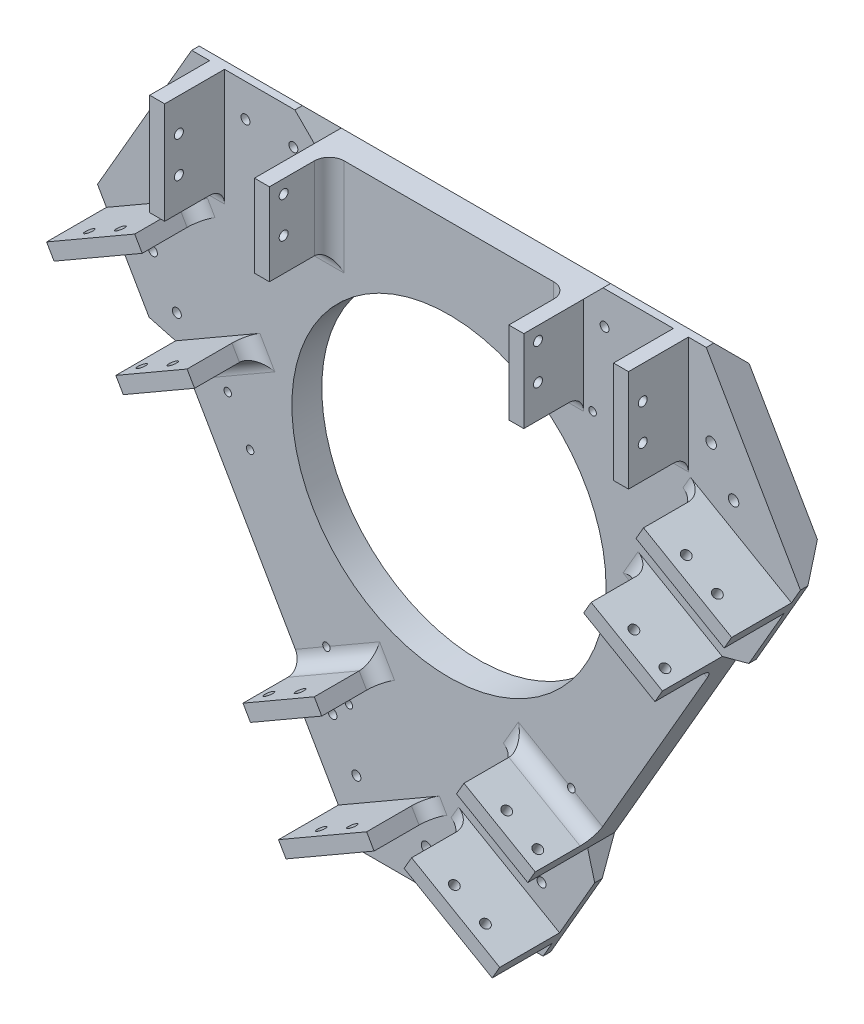
from build123d import *

# Parameters (mm, degrees)
ESQUISSE1_R                  = 52.5
BOSS_EXTRU_1_DEPTH           = 10
ESQUISSE2_W                  = 5
ESQUISSE2_H                  = 34
BOSS_EXTRU_2_DEPTH           = 20
CONG_1_R                     = 5
ESQUISSE3_R                  = 1.5
ENL_V_MAT_EXTRU_1_DEPTH      = 232.694205151
ENL_V_MAT_EXTRU_2_REACH      = 170.79
ESQUISSE4_R                  = 1.5
ESQUISSE5_R                  = 3
ENL_V_MAT_EXTRU_3_DEPTH      = 4.25
ENL_V_MAT_EXTRU_4_REACH      = 170.79
ESQUISSE6_W                  = 90
ESQUISSE6_H                  = 6.5
R_P_TITION_CIRCULAIRE3_COUNT = 3
CHANFREIN1_SIZE              = 6.5
CHANFREIN2_SIZE              = 7.5
ENL_V_MAT_EXTRU_5_REACH      = 170.79
ESQUISSE7_R                  = 1.75
ESQUISSE8_R                  = 3.5
ENL_V_MAT_EXTRU_6_DEPTH      = 4
R_P_TITION_CIRCULAIRE4_COUNT = 3
ENL_V_MAT_EXTRU_7_REACH      = 170.79
ESQUISSE9_R                  = 1.25


with BuildPart() as part:
    # Esquisse1 → Boss.-Extru.1 (new body)
    with BuildSketch(Plane.XY):
        Polygon((-85.980761818, 85.980761818), (85.980761818, 85.980761818), (117.45190488, 31.471143062), (31.471143062, -117.45190488), (-31.471143062, -117.45190488), (-117.45190488, 31.471143062), align=None)
        Circle(ESQUISSE1_R, mode=Mode.SUBTRACT)
    extrude(amount=BOSS_EXTRU_1_DEPTH)

    # Esquisse2 → Boss.-Extru.2 (add)
    with BuildSketch(Plane.XY.offset(10)):
        with Locations((77.5, 68.980761818)):
            Rectangle(ESQUISSE2_W, ESQUISSE2_H)
        with Locations((42.5, 68.980761818)):
            Rectangle(ESQUISSE2_W, ESQUISSE2_H)
        with Locations((-42.5, 68.980761818)):
            Rectangle(ESQUISSE2_W, ESQUISSE2_H)
        with Locations((-77.5, 68.980761818)):
            Rectangle(ESQUISSE2_W, ESQUISSE2_H)
        Polygon((34.461523971, -112.272413212), (5.016660242, -95.272413212), (7.516660242, -90.942286193), (36.961523971, -107.942286193), align=None)
        Polygon((51.961523971, -81.961524079), (22.516660242, -64.961524079), (25.016660242, -60.63139706), (54.461523971, -77.63139706), align=None)
        Polygon((94.461523971, -8.349364758), (65.016660242, 8.650635242), (67.516660242, 12.980762261), (96.961523971, -4.019237739), align=None)
        Polygon((111.961523971, 21.961524375), (82.516660242, 38.961524375), (85.016660242, 43.291651394), (114.461523971, 26.291651394), align=None)
        Polygon((-114.461523971, 26.291651394), (-85.016660242, 43.291651394), (-82.516660242, 38.961524375), (-111.961523971, 21.961524375), align=None)
        Polygon((-96.961523971, -4.019237739), (-67.516660242, 12.980762261), (-65.016660242, 8.650635242), (-94.461523971, -8.349364758), align=None)
        Polygon((-54.461523971, -77.63139706), (-25.016660242, -60.63139706), (-22.516660242, -64.961524079), (-51.961523971, -81.961524079), align=None)
        Polygon((-36.961523971, -107.942286193), (-7.516660242, -90.942286193), (-5.016660242, -95.272413212), (-34.461523971, -112.272413212), align=None)
    extrude(amount=BOSS_EXTRU_2_DEPTH)

    # Congé1
    cong_1_edges = [part.edges().sort_by_distance(p)[0] for p in [
        (83.766660242, 41.126587884, 10),
        (-83.766660242, 41.126587884, 10),
        (-79.739092107, 0.150635242, 10),
        (-66.266660242, 10.815698752, 10),
        (-23.766660242, -62.79646057, 10),
        (-39.739092107, -69.13139706, 10),
        (-6.266660242, -93.107349702, 10),
        (77.5, 51.980761818, 10),
        (40, 68.980761818, 10),
        (42.5, 51.980761818, 10),
        (-40, 68.980761818, 10),
        (-42.5, 51.980761818, 10),
        (-77.5, 51.980761818, 10),
        (6.266660242, -93.107349702, 10),
        (39.739092107, -69.13139706, 10),
        (23.766660242, -62.79646057, 10),
        (66.266660242, 10.815698752, 10),
        (79.739092107, 0.150635242, 10),
    ]]
    fillet(cong_1_edges, radius=CONG_1_R)

    # Esquisse3 → Enlèv. mat.-Extru.1 (cut, through all)
    with BuildSketch(Plane.ZY.offset(80)):
        with Locations((25.25, 74.980761818)):
            Circle(ESQUISSE3_R)
        with Locations((25.25, 62.980761818)):
            Circle(ESQUISSE3_R)
    enl_v_mat_extru_1 = extrude(amount=-ENL_V_MAT_EXTRU_1_DEPTH, mode=Mode.SUBTRACT)

    # Esquisse4 → Enlèv. mat.-Extru.2 (cut, up to next)
    with BuildSketch(Plane(origin=(0, 0, 0), x_dir=(-1, 0, 0), z_dir=(0, 0, -1)), mode=Mode.PRIVATE) as enl_v_mat_extru_2_sk1:
        with Locations((68, 74.980761818)):
            Circle(ESQUISSE4_R)
    enl_v_mat_extru_2_tool1 = extrude(enl_v_mat_extru_2_sk1.sketch, amount=-ENL_V_MAT_EXTRU_2_REACH, mode=Mode.PRIVATE) & part.part
    # Esquisse4 → Enlèv. mat.-Extru.2 (cut, up to next)
    with BuildSketch(Plane(origin=(0, 0, 0), x_dir=(-1, 0, 0), z_dir=(0, 0, -1)), mode=Mode.PRIVATE) as enl_v_mat_extru_2_sk2:
        with Locations((52, 74.980761818)):
            Circle(ESQUISSE4_R)
    enl_v_mat_extru_2_tool2 = extrude(enl_v_mat_extru_2_sk2.sketch, amount=-ENL_V_MAT_EXTRU_2_REACH, mode=Mode.PRIVATE) & part.part
    # Esquisse4 → Enlèv. mat.-Extru.2 (cut, up to next)
    with BuildSketch(Plane(origin=(0, 0, 0), x_dir=(-1, 0, 0), z_dir=(0, 0, -1)), mode=Mode.PRIVATE) as enl_v_mat_extru_2_sk3:
        with Locations((-52, 74.980761818)):
            Circle(ESQUISSE4_R)
    enl_v_mat_extru_2_tool3 = extrude(enl_v_mat_extru_2_sk3.sketch, amount=-ENL_V_MAT_EXTRU_2_REACH, mode=Mode.PRIVATE) & part.part
    # Esquisse4 → Enlèv. mat.-Extru.2 (cut, up to next)
    with BuildSketch(Plane(origin=(0, 0, 0), x_dir=(-1, 0, 0), z_dir=(0, 0, -1)), mode=Mode.PRIVATE) as enl_v_mat_extru_2_sk4:
        with Locations((-68, 74.980761818)):
            Circle(ESQUISSE4_R)
    enl_v_mat_extru_2_tool4 = extrude(enl_v_mat_extru_2_sk4.sketch, amount=-ENL_V_MAT_EXTRU_2_REACH, mode=Mode.PRIVATE) & part.part
    enl_v_mat_extru_2_1 = enl_v_mat_extru_2_tool1.solids().sort_by_distance((-68, 74.980762, 0))[0]
    add(enl_v_mat_extru_2_1, mode=Mode.SUBTRACT)
    enl_v_mat_extru_2_2 = enl_v_mat_extru_2_tool2.solids().sort_by_distance((-52, 74.980762, 0))[0]
    add(enl_v_mat_extru_2_2, mode=Mode.SUBTRACT)
    enl_v_mat_extru_2_3 = enl_v_mat_extru_2_tool3.solids().sort_by_distance((52, 74.980762, 0))[0]
    add(enl_v_mat_extru_2_3, mode=Mode.SUBTRACT)
    enl_v_mat_extru_2_4 = enl_v_mat_extru_2_tool4.solids().sort_by_distance((68, 74.980762, 0))[0]
    add(enl_v_mat_extru_2_4, mode=Mode.SUBTRACT)
    enl_v_mat_extru_2 = enl_v_mat_extru_2_1 + enl_v_mat_extru_2_2 + enl_v_mat_extru_2_3 + enl_v_mat_extru_2_4  # Enlèv. mat.-Extru.2 as one shape, for the pattern or mirror that repeats it

    # Esquisse5 → Enlèv. mat.-Extru.3 (cut)
    with BuildSketch(Plane(origin=(0, 0, 0), x_dir=(-1, 0, 0), z_dir=(0, 0, -1))):
        with Locations((68, 74.980761818)):
            Circle(ESQUISSE5_R)
        with Locations((52, 74.980761818)):
            Circle(ESQUISSE5_R)
        with Locations((-52, 74.980761818)):
            Circle(ESQUISSE5_R)
        with Locations((-68, 74.980761818)):
            Circle(ESQUISSE5_R)
    enl_v_mat_extru_3 = extrude(amount=-ENL_V_MAT_EXTRU_3_DEPTH, mode=Mode.SUBTRACT)

    # Esquisse6 → Enlèv. mat.-Extru.4 (cut, up to next)
    with BuildSketch(Plane(origin=(0, 0, 0), x_dir=(-1, 0, 0), z_dir=(0, 0, -1)), mode=Mode.PRIVATE) as enl_v_mat_extru_4_sk1:
        with Locations((0, 82.730761818)):
            Rectangle(ESQUISSE6_W, ESQUISSE6_H)
    enl_v_mat_extru_4_tool1 = extrude(enl_v_mat_extru_4_sk1.sketch, amount=-ENL_V_MAT_EXTRU_4_REACH, mode=Mode.PRIVATE) & part.part
    enl_v_mat_extru_4 = enl_v_mat_extru_4_tool1.solids().sort_by_distance((0, 82.730762, 0))[0]
    add(enl_v_mat_extru_4, mode=Mode.SUBTRACT)

    # Répétition circulaire3: Enlèv. mat.-Extru.1, Enlèv. mat.-Extru.2, Enlèv. mat.-Extru.3, Enlèv. mat.-Extru.4 ×3 about axis
    r_p_tition_circulaire3_axis = Axis((0, 0, 0), (0, 0, 1))
    add([enl_v_mat_extru_1.rotate(r_p_tition_circulaire3_axis, i * 360 / R_P_TITION_CIRCULAIRE3_COUNT) for i in range(1, R_P_TITION_CIRCULAIRE3_COUNT)], mode=Mode.SUBTRACT)
    add([enl_v_mat_extru_2.rotate(r_p_tition_circulaire3_axis, i * 360 / R_P_TITION_CIRCULAIRE3_COUNT) for i in range(1, R_P_TITION_CIRCULAIRE3_COUNT)], mode=Mode.SUBTRACT)
    add([enl_v_mat_extru_3.rotate(r_p_tition_circulaire3_axis, i * 360 / R_P_TITION_CIRCULAIRE3_COUNT) for i in range(1, R_P_TITION_CIRCULAIRE3_COUNT)], mode=Mode.SUBTRACT)
    add([enl_v_mat_extru_4.rotate(r_p_tition_circulaire3_axis, i * 360 / R_P_TITION_CIRCULAIRE3_COUNT) for i in range(1, R_P_TITION_CIRCULAIRE3_COUNT)], mode=Mode.SUBTRACT)

    # Chanfrein1
    chanfrein1_edges = [part.edges().sort_by_distance(p)[0] for p in [
        (-45, 85.980761818, 5),
        (45, 85.980761818, 5),
        (-51.961523971, -81.961524079, 5),
        (-96.961523971, -4.019237739, 5),
        (96.961523971, -4.019237739, 5),
        (51.961523971, -81.961524079, 5),
    ]]
    chamfer(chanfrein1_edges, length=CHANFREIN1_SIZE - 0.0001)  # a hair under: the kernel refuses the full size

    # Chanfrein2
    chanfrein2_edges = [part.edges().sort_by_distance(p)[0] for p in [
        (-68.740330909, 85.980761818, 0),
        (108.831689426, 16.540491923, 0),
        (-108.831689426, 16.540491923, 0),
    ]]
    chamfer(chanfrein2_edges, length=CHANFREIN2_SIZE)

    # Esquisse7 → Enlèv. mat.-Extru.5 (cut, up to next)
    with BuildSketch(Plane(origin=(0, 0, 0), x_dir=(-1, 0, 0), z_dir=(0, 0, -1)), mode=Mode.PRIVATE) as enl_v_mat_extru_5_sk1:
        with Locations((95.115679805, 46.254809302)):
            Circle(ESQUISSE7_R)
    enl_v_mat_extru_5_tool1 = extrude(enl_v_mat_extru_5_sk1.sketch, amount=-ENL_V_MAT_EXTRU_5_REACH, mode=Mode.PRIVATE) & part.part
    # Esquisse7 → Enlèv. mat.-Extru.5 (cut, up to next)
    with BuildSketch(Plane(origin=(0, 0, 0), x_dir=(-1, 0, 0), z_dir=(0, 0, -1)), mode=Mode.PRIVATE) as enl_v_mat_extru_5_sk2:
        with Locations((87.615679805, 59.245190358)):
            Circle(ESQUISSE7_R)
    enl_v_mat_extru_5_tool2 = extrude(enl_v_mat_extru_5_sk2.sketch, amount=-ENL_V_MAT_EXTRU_5_REACH, mode=Mode.PRIVATE) & part.part
    enl_v_mat_extru_5_1 = enl_v_mat_extru_5_tool1.solids().sort_by_distance((-95.11568, 46.254809, 0))[0]
    add(enl_v_mat_extru_5_1, mode=Mode.SUBTRACT)
    enl_v_mat_extru_5_2 = enl_v_mat_extru_5_tool2.solids().sort_by_distance((-87.61568, 59.24519, 0))[0]
    add(enl_v_mat_extru_5_2, mode=Mode.SUBTRACT)
    enl_v_mat_extru_5 = enl_v_mat_extru_5_1 + enl_v_mat_extru_5_2  # Enlèv. mat.-Extru.5 as one shape, for the pattern or mirror that repeats it

    # Esquisse8 → Enlèv. mat.-Extru.6 (cut)
    with BuildSketch(Plane(origin=(0, 0, 0), x_dir=(-1, 0, 0), z_dir=(0, 0, -1))):
        with Locations((95.115679805, 46.254809302)):
            Circle(ESQUISSE8_R)
        with Locations((87.615679805, 59.245190358)):
            Circle(ESQUISSE8_R)
    enl_v_mat_extru_6 = extrude(amount=-ENL_V_MAT_EXTRU_6_DEPTH, mode=Mode.SUBTRACT)

    # Répétition circulaire4: Enlèv. mat.-Extru.5, Enlèv. mat.-Extru.6 ×3 about axis
    r_p_tition_circulaire4_axis = Axis((0, 0, 0), (0, 0, 1))
    add([enl_v_mat_extru_5.rotate(r_p_tition_circulaire4_axis, i * 360 / R_P_TITION_CIRCULAIRE4_COUNT) for i in range(1, R_P_TITION_CIRCULAIRE4_COUNT)], mode=Mode.SUBTRACT)
    add([enl_v_mat_extru_6.rotate(r_p_tition_circulaire4_axis, i * 360 / R_P_TITION_CIRCULAIRE4_COUNT) for i in range(1, R_P_TITION_CIRCULAIRE4_COUNT)], mode=Mode.SUBTRACT)

    # Esquisse9 → Enlèv. mat.-Extru.7 (cut, up to next)
    with BuildSketch(Plane(origin=(0, 0, 0), x_dir=(-1, 0, 0), z_dir=(0, 0, -1)), mode=Mode.PRIVATE) as enl_v_mat_extru_7_sk1:
        with Locations((33.440054001, -77.041651098)):
            Circle(ESQUISSE9_R)
    enl_v_mat_extru_7_tool1 = extrude(enl_v_mat_extru_7_sk1.sketch, amount=-ENL_V_MAT_EXTRU_7_REACH, mode=Mode.PRIVATE) & part.part
    # Esquisse9 → Enlèv. mat.-Extru.7 (cut, up to next)
    with BuildSketch(Plane(origin=(0, 0, 0), x_dir=(-1, 0, 0), z_dir=(0, 0, -1)), mode=Mode.PRIVATE) as enl_v_mat_extru_7_sk2:
        with Locations((40.940054001, -64.051270041)):
            Circle(ESQUISSE9_R)
    enl_v_mat_extru_7_tool2 = extrude(enl_v_mat_extru_7_sk2.sketch, amount=-ENL_V_MAT_EXTRU_7_REACH, mode=Mode.PRIVATE) & part.part
    # Esquisse9 → Enlèv. mat.-Extru.7 (cut, up to next)
    with BuildSketch(Plane(origin=(0, 0, 0), x_dir=(-1, 0, 0), z_dir=(0, 0, -1)), mode=Mode.PRIVATE) as enl_v_mat_extru_7_sk3:
        with Locations((66.440054001, -19.883974448)):
            Circle(ESQUISSE9_R)
    enl_v_mat_extru_7_tool3 = extrude(enl_v_mat_extru_7_sk3.sketch, amount=-ENL_V_MAT_EXTRU_7_REACH, mode=Mode.PRIVATE) & part.part
    # Esquisse9 → Enlèv. mat.-Extru.7 (cut, up to next)
    with BuildSketch(Plane(origin=(0, 0, 0), x_dir=(-1, 0, 0), z_dir=(0, 0, -1)), mode=Mode.PRIVATE) as enl_v_mat_extru_7_sk4:
        with Locations((73.940054001, -6.893593392)):
            Circle(ESQUISSE9_R)
    enl_v_mat_extru_7_tool4 = extrude(enl_v_mat_extru_7_sk4.sketch, amount=-ENL_V_MAT_EXTRU_7_REACH, mode=Mode.PRIVATE) & part.part
    # Esquisse9 → Enlèv. mat.-Extru.7 (cut, up to next)
    with BuildSketch(Plane(origin=(0, 0, 0), x_dir=(-1, 0, 0), z_dir=(0, 0, -1)), mode=Mode.PRIVATE) as enl_v_mat_extru_7_sk5:
        with Locations((-73.940054001, -6.893593392)):
            Circle(ESQUISSE9_R)
    enl_v_mat_extru_7_tool5 = extrude(enl_v_mat_extru_7_sk5.sketch, amount=-ENL_V_MAT_EXTRU_7_REACH, mode=Mode.PRIVATE) & part.part
    # Esquisse9 → Enlèv. mat.-Extru.7 (cut, up to next)
    with BuildSketch(Plane(origin=(0, 0, 0), x_dir=(-1, 0, 0), z_dir=(0, 0, -1)), mode=Mode.PRIVATE) as enl_v_mat_extru_7_sk6:
        with Locations((-66.440054001, -19.883974448)):
            Circle(ESQUISSE9_R)
    enl_v_mat_extru_7_tool6 = extrude(enl_v_mat_extru_7_sk6.sketch, amount=-ENL_V_MAT_EXTRU_7_REACH, mode=Mode.PRIVATE) & part.part
    # Esquisse9 → Enlèv. mat.-Extru.7 (cut, up to next)
    with BuildSketch(Plane(origin=(0, 0, 0), x_dir=(-1, 0, 0), z_dir=(0, 0, -1)), mode=Mode.PRIVATE) as enl_v_mat_extru_7_sk7:
        with Locations((-40.940054001, -64.051270041)):
            Circle(ESQUISSE9_R)
    enl_v_mat_extru_7_tool7 = extrude(enl_v_mat_extru_7_sk7.sketch, amount=-ENL_V_MAT_EXTRU_7_REACH, mode=Mode.PRIVATE) & part.part
    # Esquisse9 → Enlèv. mat.-Extru.7 (cut, up to next)
    with BuildSketch(Plane(origin=(0, 0, 0), x_dir=(-1, 0, 0), z_dir=(0, 0, -1)), mode=Mode.PRIVATE) as enl_v_mat_extru_7_sk8:
        with Locations((-33.440054001, -77.041651098)):
            Circle(ESQUISSE9_R)
    enl_v_mat_extru_7_tool8 = extrude(enl_v_mat_extru_7_sk8.sketch, amount=-ENL_V_MAT_EXTRU_7_REACH, mode=Mode.PRIVATE) & part.part
    # Esquisse9 → Enlèv. mat.-Extru.7 (cut, up to next)
    with BuildSketch(Plane(origin=(0, 0, 0), x_dir=(-1, 0, 0), z_dir=(0, 0, -1)), mode=Mode.PRIVATE) as enl_v_mat_extru_7_sk9:
        with Locations((-58, 38.480761818)):
            Circle(ESQUISSE9_R)
    enl_v_mat_extru_7_tool9 = extrude(enl_v_mat_extru_7_sk9.sketch, amount=-ENL_V_MAT_EXTRU_7_REACH, mode=Mode.PRIVATE) & part.part
    # Esquisse9 → Enlèv. mat.-Extru.7 (cut, up to next)
    with BuildSketch(Plane(origin=(0, 0, 0), x_dir=(-1, 0, 0), z_dir=(0, 0, -1)), mode=Mode.PRIVATE) as enl_v_mat_extru_7_sk10:
        with Locations((-48, 48.480761818)):
            Circle(ESQUISSE9_R)
    enl_v_mat_extru_7_tool10 = extrude(enl_v_mat_extru_7_sk10.sketch, amount=-ENL_V_MAT_EXTRU_7_REACH, mode=Mode.PRIVATE) & part.part
    # Esquisse9 → Enlèv. mat.-Extru.7 (cut, up to next)
    with BuildSketch(Plane(origin=(0, 0, 0), x_dir=(-1, 0, 0), z_dir=(0, 0, -1)), mode=Mode.PRIVATE) as enl_v_mat_extru_7_sk11:
        with Locations((48, 48.480761818)):
            Circle(ESQUISSE9_R)
    enl_v_mat_extru_7_tool11 = extrude(enl_v_mat_extru_7_sk11.sketch, amount=-ENL_V_MAT_EXTRU_7_REACH, mode=Mode.PRIVATE) & part.part
    # Esquisse9 → Enlèv. mat.-Extru.7 (cut, up to next)
    with BuildSketch(Plane(origin=(0, 0, 0), x_dir=(-1, 0, 0), z_dir=(0, 0, -1)), mode=Mode.PRIVATE) as enl_v_mat_extru_7_sk12:
        with Locations((58, 38.480761818)):
            Circle(ESQUISSE9_R)
    enl_v_mat_extru_7_tool12 = extrude(enl_v_mat_extru_7_sk12.sketch, amount=-ENL_V_MAT_EXTRU_7_REACH, mode=Mode.PRIVATE) & part.part
    add(enl_v_mat_extru_7_tool1.solids().sort_by_distance((-33.440054, -77.041651, 0))[0], mode=Mode.SUBTRACT)
    add(enl_v_mat_extru_7_tool2.solids().sort_by_distance((-40.940054, -64.05127, 0))[0], mode=Mode.SUBTRACT)
    add(enl_v_mat_extru_7_tool3.solids().sort_by_distance((-66.440054, -19.883974, 0))[0], mode=Mode.SUBTRACT)
    add(enl_v_mat_extru_7_tool4.solids().sort_by_distance((-73.940054, -6.893593, 0))[0], mode=Mode.SUBTRACT)
    add(enl_v_mat_extru_7_tool5.solids().sort_by_distance((73.940054, -6.893593, 0))[0], mode=Mode.SUBTRACT)
    add(enl_v_mat_extru_7_tool6.solids().sort_by_distance((66.440054, -19.883974, 0))[0], mode=Mode.SUBTRACT)
    add(enl_v_mat_extru_7_tool7.solids().sort_by_distance((40.940054, -64.05127, 0))[0], mode=Mode.SUBTRACT)
    add(enl_v_mat_extru_7_tool8.solids().sort_by_distance((33.440054, -77.041651, 0))[0], mode=Mode.SUBTRACT)
    add(enl_v_mat_extru_7_tool9.solids().sort_by_distance((58, 38.480762, 0))[0], mode=Mode.SUBTRACT)
    add(enl_v_mat_extru_7_tool10.solids().sort_by_distance((48, 48.480762, 0))[0], mode=Mode.SUBTRACT)
    add(enl_v_mat_extru_7_tool11.solids().sort_by_distance((-48, 48.480762, 0))[0], mode=Mode.SUBTRACT)
    add(enl_v_mat_extru_7_tool12.solids().sort_by_distance((-58, 38.480762, 0))[0], mode=Mode.SUBTRACT)


solid = part.part
